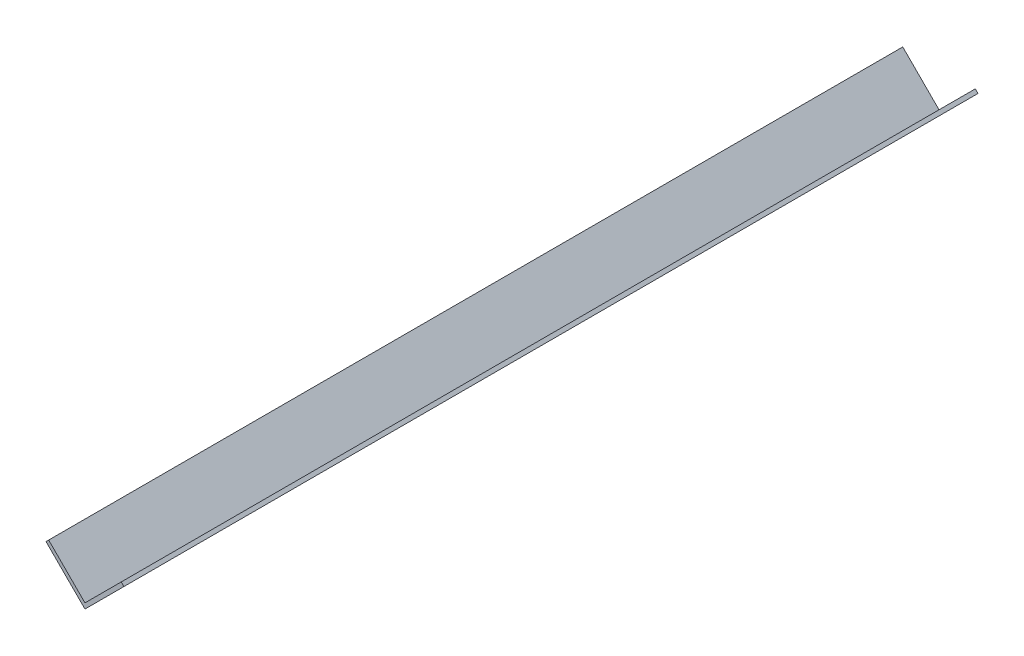
from build123d import *

# Parameters (mm, degrees)
BOSS_EXTRUDE1_DEPTH = 393.7


with BuildPart() as part:
    # Sketch1 → Boss-Extrude1 (new body)
    with BuildSketch(Plane.XY):
        Polygon((0, 0), (-17.960512242, 17.960512242), (-16.725727025, 19.195297459), (0, 2.469570433), (16.725727025, 19.195297459), (17.960512242, 17.960512242), align=None)
    extrude(amount=BOSS_EXTRUDE1_DEPTH)


solid = part.part
